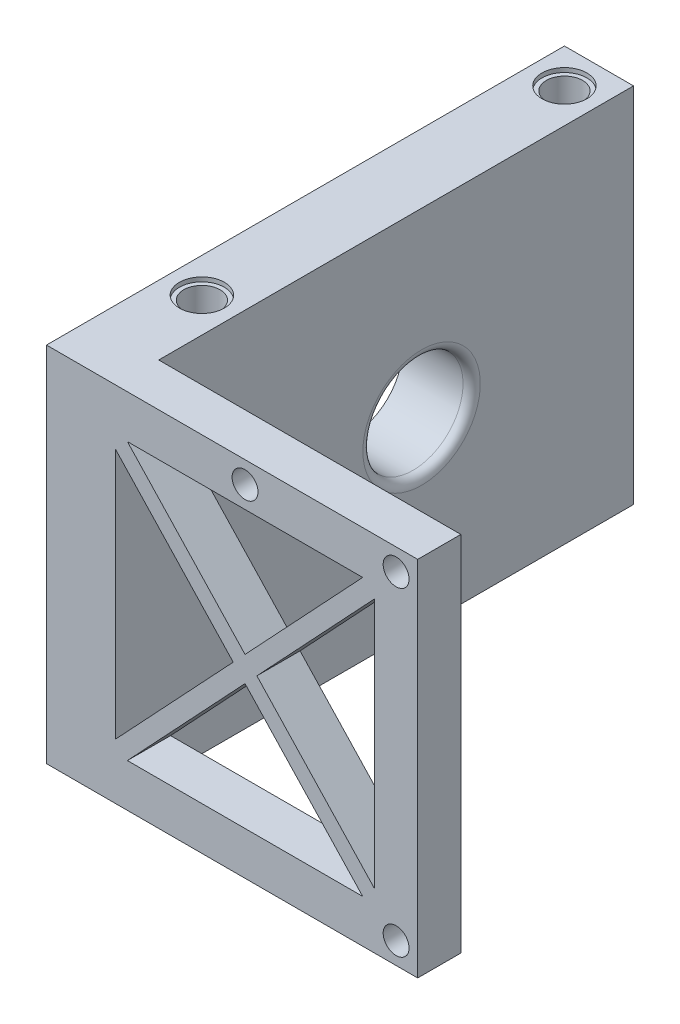
from build123d import *

# Parameters (mm, degrees)
SKETCH1_W           = 25
SKETCH1_H           = 50
SKETCH1_R           = 3.4
BOSS_EXTRUDE1_DEPTH = 3
SKETCH2_W           = 50
SKETCH2_H           = 3
BOSS_EXTRUDE2_DEPTH = 8
SKETCH3_W           = 8
SKETCH3_H           = 50
BOSS_EXTRUDE3_DEPTH = 42
SKETCH4_R           = 2.65
CUT_EXTRUDE1_DEPTH  = 0.5
SKETCH5_R           = 5.802370205
CUT_EXTRUDE2_DEPTH  = 9
FILLET2_R           = 1
SKETCH6_R           = 12.6
BOSS_EXTRUDE4_DEPTH = 2
FILLET4_R           = 1
SKETCH8_R           = 1.589780168
SKETCH8_R_2         = 1.777428262
CUT_EXTRUDE3_DEPTH  = 10
SKETCH9_W           = 49.021678163
SKETCH9_H           = 20.976854622
CUT_EXTRUDE4_DEPTH  = 68.79439129
SKETCH11_R          = 2.1
CUT_EXTRUDE5_DEPTH  = 59.480168703
SKETCH14_R          = 2.6
CUT_EXTRUDE6_DEPTH  = 0.5
SKETCH15_W          = 8
SKETCH15_H          = 42
BOSS_EXTRUDE5_DEPTH = 10
SKETCH17_W          = 5
SKETCH17_H          = 42
BOSS_EXTRUDE6_DEPTH = 35
CUT_EXTRUDE7_DEPTH  = 5
SKETCH22_R          = 1.5
CUT_EXTRUDE8_DEPTH  = 5
CHAMFER1_SIZE       = 0.5


with BuildPart() as part:
    # Sketch1 → Boss-Extrude1 (new body)
    with BuildSketch(Plane(origin=(0, 0, 0), x_dir=(1, 0, 0), z_dir=(0, 1, 0))):
        with Locations((2.276951673, 11.384758364)):
            Rectangle(SKETCH1_W, SKETCH1_H)
        with Locations(Location((1.276951673, 11.384758364, 0), (0, 0, 270))):
            Circle(SKETCH1_R, mode=Mode.SUBTRACT)
    extrude(amount=BOSS_EXTRUDE1_DEPTH)

    # Sketch2 → Boss-Extrude2 (add)
    with BuildSketch(Plane.ZY.offset(10.223048327)):
        with Locations((-11.384758364, 1.5)):
            Rectangle(SKETCH2_W, SKETCH2_H)
    extrude(amount=BOSS_EXTRUDE2_DEPTH)

    # Sketch3 → Boss-Extrude3 (add)
    with BuildSketch(Plane.XZ):
        with Locations((-14.223048327, -11.384758364)):
            Rectangle(SKETCH3_W, SKETCH3_H)
    extrude(amount=BOSS_EXTRUDE3_DEPTH)

    # Sketch4 → Cut-Extrude1 (cut)
    with BuildSketch(Plane(origin=(0, 3, 0), x_dir=(1, 0, 0), z_dir=(0, 1, 0))):
        with Locations(Location((-14.223048327, 32.384758364, 0), (0, 0, 270))):
            Circle(SKETCH4_R)
        with Locations(Location((-14.223048327, -9.615241636, 0), (0, 0, 270))):
            Circle(SKETCH4_R)
    cut_extrude1 = extrude(amount=-CUT_EXTRUDE1_DEPTH, mode=Mode.SUBTRACT)

    # Mirror1: Cut-Extrude1 across plane
    add(cut_extrude1.mirror(Plane.ZX.offset(-19.5)), mode=Mode.SUBTRACT)

    # Sketch5 → Cut-Extrude2 (cut)
    with BuildSketch(Plane.ZY.offset(18.223048327)):
        with Locations((-11.836279124, -21)):
            Circle(SKETCH5_R)
    extrude(amount=-CUT_EXTRUDE2_DEPTH, mode=Mode.SUBTRACT)

    # Fillet2
    fillet2_edges = [part.edges().sort_by_distance(p)[0] for p in [
        (-10.223048327, -21, -17.638649329),
    ]]
    fillet(fillet2_edges, radius=FILLET2_R)

    # Mirror2: Cut-Extrude1 across plane
    add(cut_extrude1.mirror(Plane.ZY.offset(1.723048327)), mode=Mode.SUBTRACT)

    # Sketch6 → Boss-Extrude4 (add)
    with BuildSketch(Plane(origin=(0, 3, 0), x_dir=(1, 0, 0), z_dir=(0, 1, 0))):
        with BuildLine():
            Line((14.776951673, 5.825082115), (14.776951673, 16.944434614))
            ThreePointArc((14.776951673, 16.944434614), (-13.323048327, 11.384758364), (14.776951673, 5.825082115))
        make_face()
        with Locations(Location((1.276951673, 11.384758364, 0), (0, 0, 270))):
            Circle(SKETCH6_R, mode=Mode.SUBTRACT)
    extrude(amount=BOSS_EXTRUDE4_DEPTH)

    # Fillet4
    # the kernel refuses this fillet: 1 mm, written as the material it takes off along each edge
    with BuildSketch(Plane(origin=(14.776951673, 5, -3.325082115), x_dir=(0, -1, 0), z_dir=(0, 0, -1))) as fillet4_piece_1:
        with BuildLine():
            CenterArc((FILLET4_R, FILLET4_R), FILLET4_R, 180, 90)
            Line((0, FILLET4_R), (0, 0))
            Line((0, 0), (FILLET4_R, 0))
        make_face()
    extrude(amount=16.119352499, mode=Mode.SUBTRACT)

    # Sketch8 → Cut-Extrude3 (cut)
    with BuildSketch(Plane(origin=(0, 3, 0), x_dir=(1, 0, 0), z_dir=(0, 1, 0))):
        with Locations(Location((1.276951673, 19.884758364, 0), (0, 0, 270))):
            Circle(SKETCH8_R)
        with Locations(Location((1.276951673, 2.884758364, 0), (0, 0, 270))):
            Circle(SKETCH8_R_2)
    extrude(amount=-CUT_EXTRUDE3_DEPTH, mode=Mode.SUBTRACT)

    # Sketch9 → Cut-Extrude4 (cut, through all)
    with BuildSketch(Plane.XY.offset(13.615241636)):
        with Locations((-9.733887409, 10.488427311)):
            Rectangle(SKETCH9_W, SKETCH9_H)
    extrude(amount=-CUT_EXTRUDE4_DEPTH, mode=Mode.SUBTRACT)

    # Sketch11 → Cut-Extrude5 (cut, through all)
    with BuildSketch(Plane(origin=(0, 0, 0), x_dir=(1, 0, 0), z_dir=(0, 1, 0))):
        with Locations(Location((-14.223048327, 32.384758364, 0), (0, 0, 270))):
            Circle(SKETCH11_R)
    cut_extrude5 = extrude(amount=-CUT_EXTRUDE5_DEPTH, mode=Mode.SUBTRACT)

    # Mirror3: Cut-Extrude5 across plane
    add(cut_extrude5.mirror(Plane.XY.offset(-11.384758364)), mode=Mode.SUBTRACT)

    # Sketch14 → Cut-Extrude6 (cut)
    with BuildSketch(Plane(origin=(0, 0, 0), x_dir=(1, 0, 0), z_dir=(0, 1, 0))):
        with Locations(Location((-14.223048327, -9.615241636, 0), (0, 0, 270))):
            Circle(SKETCH14_R)
    cut_extrude6 = extrude(amount=-CUT_EXTRUDE6_DEPTH, mode=Mode.SUBTRACT)

    # Mirror4: Cut-Extrude6 across plane
    add(cut_extrude6.mirror(Plane.XY.offset(-11.384758364)), mode=Mode.SUBTRACT)

    # Sketch15 → Boss-Extrude5 (add)
    with BuildSketch(Plane.XY.offset(13.615241636)):
        with Locations((-14.223048327, -21)):
            Rectangle(SKETCH15_W, SKETCH15_H)
    extrude(amount=BOSS_EXTRUDE5_DEPTH)

    # Sketch17 → Boss-Extrude6 (add)
    with BuildSketch(Plane(origin=(-10.223048327, 0, 0), x_dir=(0, 0, -1), z_dir=(1, 0, 0))):
        with Locations((-21.115241636, -21)):
            Rectangle(SKETCH17_W, SKETCH17_H)
    extrude(amount=BOSS_EXTRUDE6_DEPTH)

    # Sketch21 → Cut-Extrude7 (cut)
    with BuildSketch(Plane.XY.offset(23.615241636)):
        Polygon((3.40621966, -21), (-10.223048327, -6.462114147), (-10.223048327, -35.537885853), align=None)
        Polygon((18.40621966, -5), (-8.852316315, -5), (4.776951673, -19.537885853), align=None)
        Polygon((19.776951673, -35.537885853), (19.776951673, -6.462114147), (6.147683685, -21), align=None)
        Polygon((4.776951673, -22.462114147), (-8.852316315, -37), (18.40621966, -37), align=None)
    extrude(amount=-CUT_EXTRUDE7_DEPTH, mode=Mode.SUBTRACT)

    # Sketch22 → Cut-Extrude8 (cut)
    with BuildSketch(Plane.XY.offset(23.615241636)):
        with Locations((22.276951673, -2.5)):
            Circle(SKETCH22_R)
        with Locations((22.276951673, -39.5)):
            Circle(SKETCH22_R)
        with Locations((4.776951673, -2.5)):
            Circle(SKETCH22_R)
    extrude(amount=-CUT_EXTRUDE8_DEPTH, mode=Mode.SUBTRACT)

    # Chamfer1
    chamfer1_edges = [part.edges().sort_by_distance(p)[0] for p in [
        (3.276951673, -2.5, 18.615241636),
        (20.776951673, -39.5, 18.615241636),
        (20.776951673, -2.5, 18.615241636),
    ]]
    chamfer(chamfer1_edges, length=CHAMFER1_SIZE)


solid = part.part
